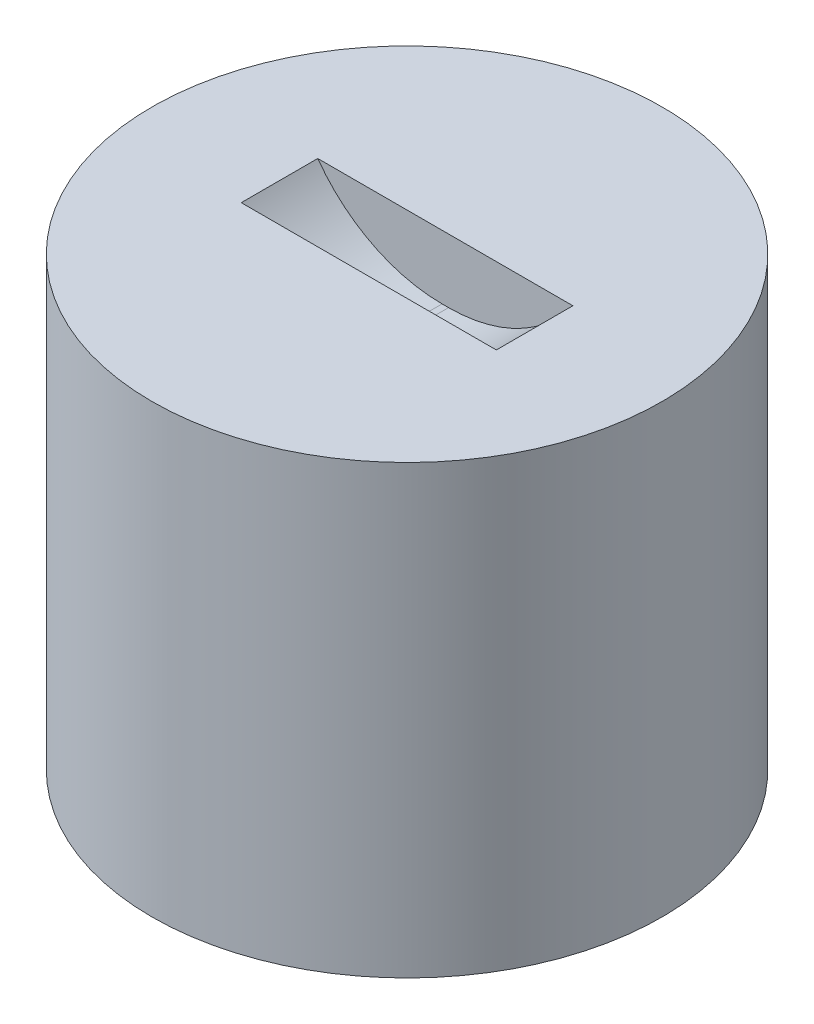
from build123d import *

# Parameters (mm, degrees)
SKETCH1_R           = 20
BOSS_EXTRUDE1_DEPTH = 35
SKETCH2_W           = 20
SKETCH2_H           = 6
CUT_EXTRUDE1_DEPTH  = 5
FILLET1_R           = 12


with BuildPart() as part:
    # Sketch1 → Boss-Extrude1 (new body)
    with BuildSketch(Plane(origin=(0, 0, 0), x_dir=(1, 0, 0), z_dir=(0, 1, 0))):
        with Locations(Location((0, 0, 0), (0, 0, 270))):
            Circle(SKETCH1_R)
    extrude(amount=BOSS_EXTRUDE1_DEPTH)

    # Sketch2 → Cut-Extrude1 (cut)
    with BuildSketch(Plane(origin=(0, 35, 0), x_dir=(1, 0, 0), z_dir=(0, 1, 0))):
        Rectangle(SKETCH2_W, SKETCH2_H)
    extrude(amount=-CUT_EXTRUDE1_DEPTH, mode=Mode.SUBTRACT)

    # Fillet1
    # the kernel refuses this fillet: 12 mm, written as the material it adds along each edge
    with BuildSketch(Plane(origin=(10, 30, 3), x_dir=(0, 1, 0), z_dir=(0, 0, -1)), Plane(origin=(-10, 30, -3), x_dir=(0, 1, 0), z_dir=(0, 0, 1))) as fillet1_piece_1:
        with BuildLine():
            CenterArc((12, -9.746794345), FILLET1_R, 125.685334713, 54.314665287)
            Line((0, -9.746794345), (0, 0))
            Line((0, 0), (5, 0))
        make_face()
    extrude(amount=6)


solid = part.part
